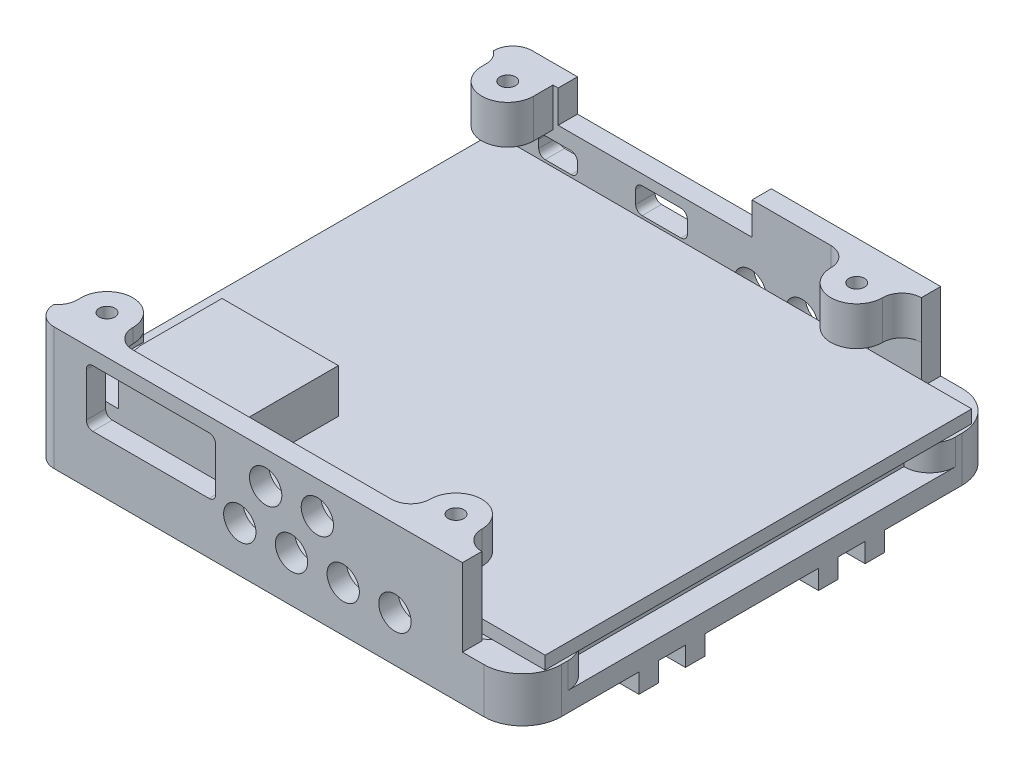
from build123d import *

# Parameters (mm, degrees)
SKETCH1_W                           = 38
SKETCH1_H                           = 33
BOSS_EXTRUDE1_DEPTH                 = 1.5
BOSS_EXTRUDE2_DEPTH                 = 2
BOSS_EXTRUDE2_DEPTH_BACK            = 1.5
SKETCH2_R                           = 2
F_1_2_1_2_DIAMETER_HOLE1_D          = 1.2
SKETCH5_W                           = 37
SKETCH5_H                           = 33
BOSS_EXTRUDE3_DEPTH                 = 1
SKETCH6_W                           = 9
SKETCH6_H                           = 8
BOSS_EXTRUDE4_DEPTH                 = 3.4
SKETCH7_W                           = 38
SKETCH7_H                           = 1.5
BOSS_EXTRUDE5_DEPTH                 = 9.5
BOSS_EXTRUDE6_DEPTH                 = 3
CUT_EXTRUDE1_START                  = -1
CUT_EXTRUDE1_DEPTH                  = 1
SKETCH12_W                          = 38
SKETCH12_H                          = 2
BOSS_EXTRUDE7_DEPTH                 = 1.5
FILLET1_R                           = 1.5
SKETCH11_W                          = 0.6
SKETCH11_H                          = 6
F_1_2_1_2_DIAMETER_HOLE2_AT_2_COUNT = 2
F_1_2_1_2_DIAMETER_HOLE2_AT_2_PITCH = 27
F_1_2_1_2_DIAMETER_HOLE2_AT_3_COUNT = 2
F_1_2_1_2_DIAMETER_HOLE2_AT_3_PITCH = 41.109609582
F_1_2_1_2_DIAMETER_HOLE2_AT_4_COUNT = 2
F_1_2_1_2_DIAMETER_HOLE2_AT_4_PITCH = 31
CUT_EXTRUDE2_START                  = 7.5
CUT_EXTRUDE2_DEPTH                  = 0.4
CUT_EXTRUDE2_START_2                = -4.428285786
CUT_EXTRUDE2_2_DEPTH                = 4.428285786
SKETCH14_W                          = 15
SKETCH14_H                          = 12.618354367
CUT_EXTRUDE3_DEPTH                  = 2.5
SKETCH15_W                          = 4
SKETCH15_H                          = 2
SKETCH15_W_2                        = 3
SKETCH15_H_2                        = 1.6
CUT_EXTRUDE4_DEPTH                  = 1.5
SKETCH20_W                          = 38
SKETCH20_H                          = 1.5
BOSS_EXTRUDE10_DEPTH                = 3
SKETCH31_W                          = 2
SKETCH31_H                          = 28.8
BOSS_EXTRUDE14_DEPTH                = 1.9
CUT_EXTRUDE16_START                 = -9
SKETCH38_W                          = 4.9
SKETCH38_H                          = 37
CUT_EXTRUDE16_DEPTH                 = 9
FILL_START                          = -18.5
FILL_PATTERN1_OUTLINE_R             = 1.25
FILL_PATTERN1_DEPTH                 = 1.5
FILL_START_2                        = 17
FILL_PATTERN2_OUTLINE_R             = 1.25
FILL_PATTERN2_DEPTH                 = 1.5
SKETCH18_W                          = 33
SKETCH18_H                          = 8.8
CUT_EXTRUDE6_DEPTH                  = 1.6
SKETCH21_W                          = 15
SKETCH21_H                          = 1.5
CUT_EXTRUDE7_DEPTH                  = 1
SKETCH35_W                          = 38
SKETCH35_H                          = 1.5
BOSS_EXTRUDE16_DEPTH                = 1.5
SKETCH36_W                          = 28
SKETCH36_H                          = 28
CUT_EXTRUDE14_DEPTH                 = 29.709754504
SKETCH37_R                          = 0.6
CUT_EXTRUDE15_DEPTH                 = 29.004463996
FILLET5_R                           = 0.5
SKETCH39_W                          = 33.1
SKETCH39_H                          = 37
CUT_EXTRUDE17_DEPTH                 = 3
CUT_EXTRUDE18_START                 = -0.5
CUT_EXTRUDE18_DEPTH                 = 0.5
SKETCH41_W                          = 38.00290301
SKETCH41_H                          = 8.298006942
CUT_EXTRUDE20_DEPTH                 = 0.25
FILLET6_R                           = 1.5
FILLET7_R                           = 3


# Read off the part's stored shape, not the designer's step: Cut-Extrude2, Fill Pattern1, Fill Pattern2
with BuildPart() as part:
    # Sketch1 → Boss-Extrude1 (new body)
    with BuildSketch(Plane(origin=(0, 0, 0), x_dir=(1, 0, 0), z_dir=(0, 1, 0))):
        Rectangle(SKETCH1_W, SKETCH1_H)
    extrude(amount=BOSS_EXTRUDE1_DEPTH)

    # Sketch2 → Boss-Extrude2 (add, two sides: drawn at the far end of the back side and taken through both)
    with BuildSketch(Plane(origin=(0, 1.5, 0), x_dir=(1, 0, 0), z_dir=(0, 1, 0)).offset(-BOSS_EXTRUDE2_DEPTH_BACK)):
        with Locations(Location((-16.75, 9.75, 0), (0, 0, 270))):
            Circle(SKETCH2_R)
        with Locations(Location((-16.75, -9.75, 0), (0, 0, 270))):
            Circle(SKETCH2_R)
        with BuildLine():
            Line((16.75, 17), (18.75, 17))
            Line((18.75, 17), (18.75, 15))
            ThreePointArc((18.75, 15), (15.335786438, 13.585786438), (16.75, 17))
        make_face()
        with BuildLine():
            Line((16.75, -17), (18.75, -17))
            Line((18.75, -17), (18.75, -15))
            ThreePointArc((18.75, -15), (15.335786438, -13.585786438), (16.75, -17))
        make_face()
    extrude(amount=BOSS_EXTRUDE2_DEPTH + BOSS_EXTRUDE2_DEPTH_BACK)

    # Ø1.2 (1.2) Diameter Hole1 (through all)
    with Locations(Plane(origin=(0, 3.5, 0), x_dir=(1, 0, 0), z_dir=(0, 1, 0))):
        with Locations((-16.75, 9.75), (-16.75, -9.75), (16.75, -15), (16.75, 15)):
            Hole(F_1_2_1_2_DIAMETER_HOLE1_D / 2)

    # Sketch7 → Boss-Extrude5 (add)
    with BuildSketch(Plane(origin=(0, 0, 0), x_dir=(1, 0, 0), z_dir=(0, 1, 0))):
        with Locations((0, 17.75)):
            Rectangle(SKETCH7_W, SKETCH7_H)
        with Locations((0, -17.75)):
            Rectangle(SKETCH7_W, SKETCH7_H)
    extrude(amount=BOSS_EXTRUDE5_DEPTH)

    # Sketch8 → Boss-Extrude6 (add)
    with BuildSketch(Plane(origin=(0, 9.5, 0), x_dir=(1, 0, 0), z_dir=(0, 1, 0))):
        with BuildLine():
            Line((12.6, 15.5), (12.6, 18.5))
            Line((12.6, 18.5), (8.6, 18.5))
            Line((8.6, 18.5), (8.6, 15.5))
            ThreePointArc((8.6, 15.5), (10.6, 13.5), (12.6, 15.5))
        make_face()
        with BuildLine():
            Line((-18.4, 15.5), (-18.4, 18.5))
            Line((-18.4, 18.5), (-14.4, 18.5))
            Line((-14.4, 18.5), (-14.4, 15.5))
            ThreePointArc((-14.4, 15.5), (-16.4, 13.5), (-18.4, 15.5))
        make_face()
        with BuildLine():
            Line((-18.4, -15.5), (-18.4, -18.5))
            Line((-18.4, -18.5), (-14.4, -18.5))
            Line((-14.4, -18.5), (-14.4, -15.5))
            ThreePointArc((-14.4, -15.5), (-16.4, -13.5), (-18.4, -15.5))
        make_face()
        with BuildLine():
            Line((8.6, -15.5), (8.6, -18.5))
            Line((8.6, -18.5), (12.6, -18.5))
            Line((12.6, -18.5), (12.6, -15.5))
            ThreePointArc((12.6, -15.5), (10.6, -13.5), (8.6, -15.5))
        make_face()
    extrude(amount=-BOSS_EXTRUDE6_DEPTH)

    # Sketch9 → Cut-Extrude1 (cut)
    with BuildSketch(Plane.XZ.offset(-6.5).offset(CUT_EXTRUDE1_START)):
        with BuildLine():
            Line((-14.4, 15.5), (-14.4, 17))
            Line((-14.4, 17), (-18.4, 17))
            Line((-18.4, 17), (-18.4, 15.5))
            ThreePointArc((-18.4, 15.5), (-16.4, 13.5), (-14.4, 15.5))
        make_face()
    extrude(amount=CUT_EXTRUDE1_DEPTH, mode=Mode.SUBTRACT)

    # Sketch12 → Boss-Extrude7 (add)
    with BuildSketch(Plane.XZ):
        with Locations((0, -17.5)):
            Rectangle(SKETCH12_W, SKETCH12_H)
        with Locations((0, 17.5)):
            Rectangle(SKETCH12_W, SKETCH12_H)
    extrude(amount=-BOSS_EXTRUDE7_DEPTH)

    # Fillet1
    # the kernel refuses this fillet: 1.5 mm, written as the material it adds along each edge
    with BuildSketch(Plane(origin=(12.6, 6.5, 17), x_dir=(1, 0, 0), z_dir=(0, 1, 0)), Plane(origin=(8.6, 9.5, 17), x_dir=(-1, 0, 0), z_dir=(0, -1, 0))) as fillet1_piece_1:
        with BuildLine():
            CenterArc((FILLET1_R, FILLET1_R), FILLET1_R, 180, 90)
            Line((0, FILLET1_R), (-FILLET1_R * 0.02, FILLET1_R))
            Line((-FILLET1_R * 0.02, FILLET1_R), (-FILLET1_R * 0.02, -FILLET1_R * 0.02))
            Line((-FILLET1_R * 0.02, -FILLET1_R * 0.02), (FILLET1_R, -FILLET1_R * 0.02))
            Line((FILLET1_R, -FILLET1_R * 0.02), (FILLET1_R, 0))
        make_face()
    extrude(amount=3)
    with BuildSketch(Plane(origin=(8.6, 9.5, -17), x_dir=(-1, 0, 0), z_dir=(0, -1, 0)), Plane(origin=(12.6, 6.5, -17), x_dir=(1, 0, 0), z_dir=(0, 1, 0))) as fillet1_piece_2:
        with BuildLine():
            CenterArc((FILLET1_R, -FILLET1_R), FILLET1_R, 90, 90)
            Line((0, -FILLET1_R), (-FILLET1_R * 0.02, -FILLET1_R))
            Line((-FILLET1_R * 0.02, -FILLET1_R), (-FILLET1_R * 0.02, FILLET1_R * 0.02))
            Line((-FILLET1_R * 0.02, FILLET1_R * 0.02), (FILLET1_R, FILLET1_R * 0.02))
            Line((FILLET1_R, FILLET1_R * 0.02), (FILLET1_R, 0))
        make_face()
    extrude(amount=3)
    with BuildSketch(Plane(origin=(-18.4, 6.5, -17), x_dir=(-1, 0, 0), z_dir=(0, 1, 0))) as fillet1_piece_3:
        with BuildLine():
            CenterArc((1.5, 1.2), FILLET1_R, 180, 53.130102354)
            Line((0, 1.2), (-0.03, 1.2))
            Line((-0.03, 1.2), (-0.03, 0))
            Line((-0.03, 0), (0, -0.03))
            ThreePointArc((0, -0.03), (0.3, -0.03), (0.582, -0.024))
            Line((0.582, -0.024), (0.6, 0))
        make_face()
    extrude(amount=3)
    with BuildSketch(Plane(origin=(-14.4, 7.5, 17), x_dir=(1, 0, 0), z_dir=(0, 1, 0))) as fillet1_piece_4:
        with BuildLine():
            CenterArc((FILLET1_R, FILLET1_R), FILLET1_R, 180, 90)
            Line((0, FILLET1_R), (-FILLET1_R * 0.02, FILLET1_R))
            Line((-FILLET1_R * 0.02, FILLET1_R), (-FILLET1_R * 0.02, -FILLET1_R * 0.02))
            Line((-FILLET1_R * 0.02, -FILLET1_R * 0.02), (FILLET1_R, -FILLET1_R * 0.02))
            Line((FILLET1_R, -FILLET1_R * 0.02), (FILLET1_R, 0))
        make_face()
    extrude(amount=2)
    with BuildSketch(Plane(origin=(-18.4, 9.5, 17), x_dir=(-1, 0, 0), z_dir=(0, -1, 0))) as fillet1_piece_5:
        with BuildLine():
            CenterArc((1.5, 1.2), FILLET1_R, 180, 53.130102354)
            Line((0, 1.2), (-0.03, 1.2))
            Line((-0.03, 1.2), (-0.03, 0))
            Line((-0.03, 0), (0, -0.03))
            ThreePointArc((0, -0.03), (0.3, -0.03), (0.582, -0.024))
            Line((0.582, -0.024), (0.6, 0))
        make_face()
    extrude(amount=2)

    # Sketch11 → Ø1.2 (1.2) Diameter Hole2 (revolve, cut)
    with BuildSketch(Plane(origin=(-16.4, 9.5, 15.5), x_dir=(0, 0, 1), z_dir=(1, 0, 0))):
        with Locations((0.3, 3)):
            Rectangle(SKETCH11_W, SKETCH11_H)
    f_1_2_1_2_diameter_hole2 = revolve(axis=Axis((-16.4, 15.85, 15.5), (0, -1, 0)), mode=Mode.SUBTRACT)

    # Ø1.2 (1.2) Diameter Hole2 at 2: Ø1.2 (1.2) Diameter Hole2 ×2
    with Locations(*[(i * F_1_2_1_2_DIAMETER_HOLE2_AT_2_PITCH, 0, 0) for i in range(1, F_1_2_1_2_DIAMETER_HOLE2_AT_2_COUNT)]):
        add(f_1_2_1_2_diameter_hole2, mode=Mode.SUBTRACT)

    # Ø1.2 (1.2) Diameter Hole2 at 3: Ø1.2 (1.2) Diameter Hole2 ×2
    with Locations(*[Vector(0.6567807448042019, 0, -0.7540815958863059) * (i * F_1_2_1_2_DIAMETER_HOLE2_AT_3_PITCH) for i in range(1, F_1_2_1_2_DIAMETER_HOLE2_AT_3_COUNT)]):
        add(f_1_2_1_2_diameter_hole2, mode=Mode.SUBTRACT)

    # Ø1.2 (1.2) Diameter Hole2 at 4: Ø1.2 (1.2) Diameter Hole2 ×2
    with Locations(*[(0, 0, -i * F_1_2_1_2_DIAMETER_HOLE2_AT_4_PITCH) for i in range(1, F_1_2_1_2_DIAMETER_HOLE2_AT_4_COUNT)]):
        add(f_1_2_1_2_diameter_hole2, mode=Mode.SUBTRACT)

    # Cut-Extrude2 2 outline → Cut-Extrude2 2 (cut)
    with BuildSketch(Plane.XY.offset(18.5).offset(CUT_EXTRUDE2_START_2)):
        with BuildLine():
            ThreePointArc((-5, 7.9), (-5.146446609, 8.253553391), (-5.5, 8.4))
            Line((-5.5, 8.4), (-14.5, 8.4))
            ThreePointArc((-14.5, 8.4), (-14.853553391, 8.253553391), (-15, 7.9))
            Line((-15, 7.9), (-15, 7.5))
            Line((-15, 7.5), (-15, 4.5))
            ThreePointArc((-15, 4.5), (-14.853553391, 4.146446609), (-14.5, 4))
            Line((-14.5, 4), (-5.5, 4))
            ThreePointArc((-5.5, 4), (-5.146446609, 4.146446609), (-5, 4.5))
            Line((-5, 4.5), (-5, 7.9))
        make_face()
    extrude(amount=CUT_EXTRUDE2_2_DEPTH, mode=Mode.SUBTRACT)

    # Sketch14 → Cut-Extrude3 (cut)
    with BuildSketch(Plane(origin=(0, 9.5, 0), x_dir=(1, 0, 0), z_dir=(0, 1, 0))):
        with Locations((-6.5, 16.147378524)):
            Rectangle(SKETCH14_W, SKETCH14_H)
    extrude(amount=-CUT_EXTRUDE3_DEPTH, mode=Mode.SUBTRACT)

    # Sketch15 → Cut-Extrude4 (cut)
    with BuildSketch(Plane(origin=(0, 0, -18.5), x_dir=(-1, 0, 0), z_dir=(0, 0, -1))):
        with Locations((6, 5.2)):
            Rectangle(SKETCH15_W, SKETCH15_H)
        with Locations((14, 5)):
            Rectangle(SKETCH15_W_2, SKETCH15_H_2)
    extrude(amount=-CUT_EXTRUDE4_DEPTH, mode=Mode.SUBTRACT)

    # Sketch20 → Boss-Extrude10 (add)
    with BuildSketch(Plane(origin=(0, 9.5, 0), x_dir=(1, 0, 0), z_dir=(0, 1, 0))):
        with Locations((0, -17.75)):
            Rectangle(SKETCH20_W, SKETCH20_H)
        with Locations((0, 17.75)):
            Rectangle(SKETCH20_W, SKETCH20_H)
    extrude(amount=BOSS_EXTRUDE10_DEPTH)

    # Sketch31 → Boss-Extrude14 (add)
    with BuildSketch(Plane.XZ):
        with Locations((15.75, 0)):
            Rectangle(SKETCH31_W, SKETCH31_H)
    extrude(amount=-BOSS_EXTRUDE14_DEPTH)

    # Sketch38 → Cut-Extrude16 (cut)
    with BuildSketch(Plane(origin=(0, 12.5, 0), x_dir=(1, 0, 0), z_dir=(0, 1, 0)).offset(CUT_EXTRUDE16_START)):
        with Locations((16.55, 0)):
            Rectangle(SKETCH38_W, SKETCH38_H)
    extrude(amount=CUT_EXTRUDE16_DEPTH, mode=Mode.SUBTRACT)

    # Fill Pattern1 outline → Fill Pattern1 (cut)
    with BuildSketch(Plane.XY.offset(FILL_START)):
        with Locations((0.875, 3.535898385)):
            Circle(FILL_PATTERN1_OUTLINE_R)
        with Locations((4.875, 3.535898385)):
            Circle(FILL_PATTERN1_OUTLINE_R)
        with Locations((8.875, 3.535898385)):
            Circle(FILL_PATTERN1_OUTLINE_R)
    extrude(amount=FILL_PATTERN1_DEPTH, mode=Mode.SUBTRACT)

    # Fill Pattern2 outline → Fill Pattern2 (cut)
    with BuildSketch(Plane.XY.offset(FILL_START_2)):
        with Locations((0.875, 3.535898385)):
            Circle(FILL_PATTERN2_OUTLINE_R)
        with Locations((4.875, 3.535898385)):
            Circle(FILL_PATTERN2_OUTLINE_R)
        with Locations((8.875, 3.535898385)):
            Circle(FILL_PATTERN2_OUTLINE_R)
        with Locations((-3.125, 3.535898385)):
            Circle(FILL_PATTERN2_OUTLINE_R)
        with Locations((2.875, 7)):
            Circle(FILL_PATTERN2_OUTLINE_R)
        with Locations((-1.125, 7)):
            Circle(FILL_PATTERN2_OUTLINE_R)
    extrude(amount=FILL_PATTERN2_DEPTH, mode=Mode.SUBTRACT)

    # Sketch18 → Cut-Extrude6 (cut)
    with BuildSketch(Plane(origin=(0, 1.5, 0), x_dir=(1, 0, 0), z_dir=(0, 1, 0))):
        with Locations((-2.5, 0)):
            Rectangle(SKETCH18_W, SKETCH18_H)
    extrude(amount=-CUT_EXTRUDE6_DEPTH, mode=Mode.SUBTRACT)

    # Sketch21 → Cut-Extrude7 (cut)
    with BuildSketch(Plane.XZ.offset(-9.5)):
        with Locations((-6.5, -17.75)):
            Rectangle(SKETCH21_W, SKETCH21_H)
    extrude(amount=-CUT_EXTRUDE7_DEPTH, mode=Mode.SUBTRACT)

    # Sketch35 → Boss-Extrude16 (add)
    with BuildSketch(Plane.XZ):
        with Locations((0, -8.75)):
            Rectangle(SKETCH35_W, SKETCH35_H)
        with Locations((0, 8.75)):
            Rectangle(SKETCH35_W, SKETCH35_H)
        with Locations((0, -5.15)):
            Rectangle(SKETCH35_W, SKETCH35_H)
        with Locations((0, 5.15)):
            Rectangle(SKETCH35_W, SKETCH35_H)
    extrude(amount=BOSS_EXTRUDE16_DEPTH)

    # Sketch36 → Cut-Extrude14 (cut, through all)
    with BuildSketch(Plane(origin=(0, 1.5, 0), x_dir=(1, 0, 0), z_dir=(0, 1, 0))):
        Rectangle(SKETCH36_W, SKETCH36_H)
    extrude(amount=-CUT_EXTRUDE14_DEPTH, mode=Mode.SUBTRACT)

    # Sketch37 → Cut-Extrude15 (cut, through all)
    with BuildSketch(Plane(origin=(0, 3.5, 0), x_dir=(1, 0, 0), z_dir=(0, 1, 0))):
        with Locations(Location((-16.75, -9.75, 0), (0, 0, 270))):
            Circle(SKETCH37_R)
        with Locations(Location((-16.75, 9.75, 0), (0, 0, 270))):
            Circle(SKETCH37_R)
    extrude(amount=-CUT_EXTRUDE15_DEPTH, mode=Mode.SUBTRACT)

    # Fillet5
    fillet5_edges = [part.edges().sort_by_distance(p)[0] for p in [
        (-4, 4.2, -17.75),
        (-4, 6.2, -17.75),
        (-8, 6.2, -17.75),
        (-8, 4.2, -17.75),
        (-12.5, 4.2, -17.75),
        (-12.5, 5.8, -17.75),
        (-15.5, 5.8, -17.75),
        (-15.5, 4.2, -17.75),
    ]]
    fillet(fillet5_edges, radius=FILLET5_R)

    # Sketch39 → Cut-Extrude17 (cut)
    with BuildSketch(Plane(origin=(0, 12.5, 0), x_dir=(1, 0, 0), z_dir=(0, 1, 0))):
        with Locations((-2.45, 0)):
            Rectangle(SKETCH39_W, SKETCH39_H)
    extrude(amount=-CUT_EXTRUDE17_DEPTH, mode=Mode.SUBTRACT)

    # Sketch40 → Cut-Extrude18 (cut)
    with BuildSketch(Plane.XZ.offset(-6.5).offset(CUT_EXTRUDE18_START)):
        with BuildLine():
            Line((14.1, 17), (7.1, 17))
            ThreePointArc((7.1, 17), (8.160660172, 16.560660172), (8.6, 15.5))
            ThreePointArc((8.6, 15.5), (10.6, 13.5), (12.6, 15.5))
            ThreePointArc((12.6, 15.5), (13.039339828, 16.560660172), (14.1, 17))
        make_face()
    extrude(amount=CUT_EXTRUDE18_DEPTH, mode=Mode.SUBTRACT)

    # Sketch41 → Cut-Extrude20 (cut)
    with BuildSketch(Plane(origin=(19, 0, 0), x_dir=(0, 0, -1), z_dir=(1, 0, 0))):
        with Locations((0.501451505, -0.649003471)):
            Rectangle(SKETCH41_W, SKETCH41_H)
    extrude(amount=-CUT_EXTRUDE20_DEPTH, mode=Mode.SUBTRACT)

    # Fillet6
    # the kernel refuses this fillet: 1.5 mm, written as the material it adds along each edge
    with BuildSketch(Plane(origin=(14, 1.5, -14), x_dir=(0, 0, 1), z_dir=(0, -1, 0)), Plane(origin=(-14, 1.5, -14), x_dir=(1, 0, 0), z_dir=(0, -1, 0))) as fillet6_piece_1:
        with BuildLine():
            CenterArc((FILLET6_R, FILLET6_R), FILLET6_R, 180, 90)
            Line((0, FILLET6_R), (0, 0))
            Line((0, 0), (FILLET6_R, 0))
        make_face()
    extrude(amount=1.5)
    with BuildSketch(Plane(origin=(-14, 1.5, 14), x_dir=(1, 0, 0), z_dir=(0, -1, 0)), Plane(origin=(14, 1.5, 14), x_dir=(0, 0, -1), z_dir=(0, -1, 0))) as fillet6_piece_2:
        with BuildLine():
            CenterArc((FILLET6_R, -FILLET6_R), FILLET6_R, 90, 90)
            Line((0, -FILLET6_R), (0, 0))
            Line((0, 0), (FILLET6_R, 0))
        make_face()
    extrude(amount=1.5)
    with BuildSketch(Plane(origin=(16.75, 1.5, -17), x_dir=(-1, 0, 0), z_dir=(0, 1, 0))) as fillet6_piece_3:
        with BuildLine():
            CenterArc((3.464101615, 1.5), FILLET6_R, 171.786789298, 98.213210702)
            ThreePointArc((1.979486637, 1.714285714), (1.309307341, 0.488142108), (0, 0))
            Line((0, 0), (3.464101615, 0))
        make_face()
    extrude(amount=2)
    with BuildSketch(Plane(origin=(16.75, 1.5, 17), x_dir=(-1, 0, 0), z_dir=(0, 1, 0))) as fillet6_piece_4:
        with BuildLine():
            CenterArc((3.464101615, -1.5), FILLET6_R, 90, 98.213210702)
            ThreePointArc((1.979486637, -1.714285714), (1.309307341, -0.488142108), (0, 0))
            Line((0, 0), (3.464101615, 0))
        make_face()
    extrude(amount=2)
    # the kernel refuses this fillet: 1.5 mm, written as the material it takes off along each edge
    with BuildSketch(Plane(origin=(-19, -3.75, 18.5), x_dir=(0, 0, -1), z_dir=(0, 1, 0)), Plane(origin=(-19, 13.25, -18.5), x_dir=(0, 0, 1), z_dir=(0, -1, 0))) as fillet6_2_piece_1:
        with BuildLine():
            CenterArc((FILLET6_R, -FILLET6_R), FILLET6_R, 90, 90)
            Line((0, -FILLET6_R), (0, 0))
            Line((0, 0), (FILLET6_R, 0))
        make_face()
    extrude(amount=17, mode=Mode.SUBTRACT)

    # Fillet7
    fillet7_edges = [part.edges().sort_by_distance(p)[0] for p in [
        (18.75, 1.75, 18.5),
        (18.75, 1.75, -18.5),
    ]]
    fillet(fillet7_edges, radius=FILLET7_R)


with BuildPart() as body_2:
    # Sketch5 → Boss-Extrude3 (new body)
    with BuildSketch(Plane(origin=(0, 3.5, 0), x_dir=(1, 0, 0), z_dir=(0, 1, 0))):
        Rectangle(SKETCH5_W, SKETCH5_H)
    extrude(amount=BOSS_EXTRUDE3_DEPTH)

    # Sketch6 → Boss-Extrude4 (add)
    with BuildSketch(Plane(origin=(0, 4.5, 0), x_dir=(1, 0, 0), z_dir=(0, 1, 0))):
        with Locations((-10, -12.5)):
            Rectangle(SKETCH6_W, SKETCH6_H)
    extrude(amount=BOSS_EXTRUDE4_DEPTH)

    # Cut-Extrude2 outline → Cut-Extrude2 (cut)
    with BuildSketch(Plane(origin=(0, 0, 0), x_dir=(1, 0, 0), z_dir=(0, 1, 0)).offset(CUT_EXTRUDE2_START)):
        with BuildLine():
            ThreePointArc((-14.018033989, -16.5), (-14.301258538, -16.035233134), (-14.4, -15.5))
            ThreePointArc((-14.4, -15.5), (-14.425158234, -15.183772234), (-14.5, -14.8755002))
            Line((-14.5, -14.8755002), (-14.5, -16.5))
            Line((-14.5, -16.5), (-14.018033989, -16.5))
        make_face()
    extrude(amount=CUT_EXTRUDE2_DEPTH, mode=Mode.SUBTRACT)


solid = Compound([part.part, body_2.part])
